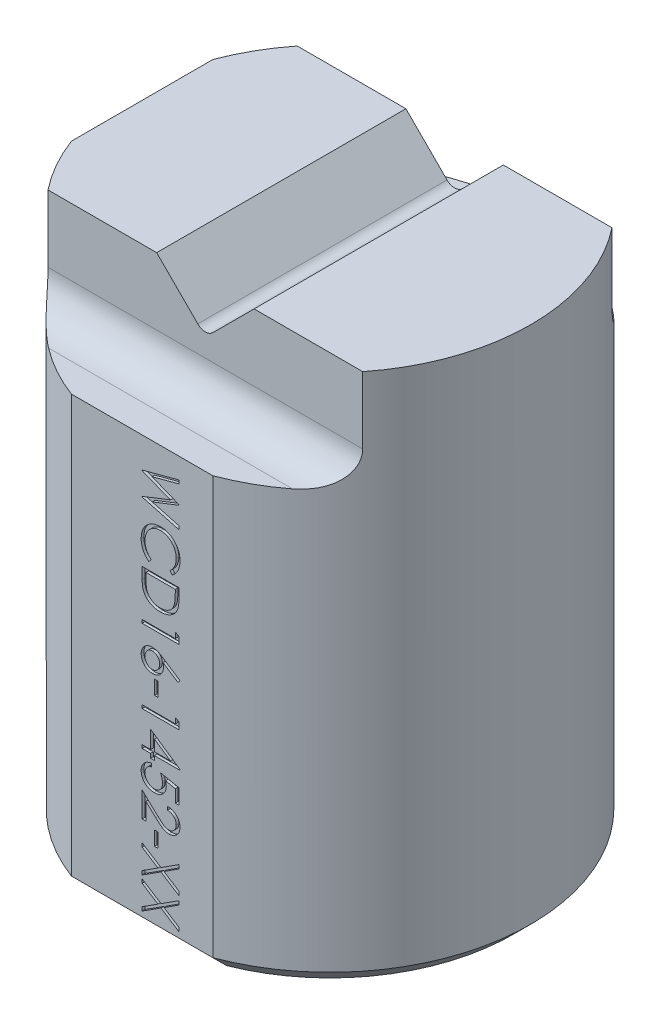
from build123d import *

# Parameters (mm, degrees)
CROQUIS1_R                 = 19.0246
SALIENTE_EXTRUIR1_DEPTH    = 50.8
CORTAR_EXTRUIR5_DEPTH      = 50.8
CORTAR_EXTRUIR5_DEPTH_BACK = 50.8
CORTAR_EXTRUIR7_DEPTH      = 50.8
CORTAR_EXTRUIR7_DEPTH_BACK = 50.8
CORTAR_EXTRUIR4_START      = -50.8
CORTAR_EXTRUIR4_DEPTH      = 50.8
CHAFL_N1_SIZE              = 1.5875
CROQUIS16_W                = 0.358974359
CROQUIS16_H                = 1.346153846
CORTAR_EXTRUIR8_DEPTH      = 0.254


with BuildPart() as part:
    # Croquis1 → Saliente-Extruir1 (new body)
    with BuildSketch(Plane(origin=(0, 0, 0), x_dir=(1, 0, 0), z_dir=(0, 1, 0))):
        with Locations(Location((0, 0, 0), (0, 0, 270))):
            Circle(CROQUIS1_R)
    extrude(amount=SALIENTE_EXTRUIR1_DEPTH)

    # Croquis12 → Cortar-Extruir5 (cut, two sides: drawn at the far end of the back side and taken through both)
    with BuildSketch(Plane(origin=(0, 0, 0), x_dir=(0, 0, -1), z_dir=(1, 0, 0)).offset(-CORTAR_EXTRUIR5_DEPTH_BACK)):
        with BuildLine():
            Line((11.811, 50.8), (19.0246, 50.8))
            Line((19.0246, 50.8), (19.0246, 41.148))
            Line((19.0246, 41.148), (15.113, 41.148))
            ThreePointArc((15.113, 41.148), (12.778133409, 42.115133409), (11.811, 44.45))
            Line((11.811, 44.45), (11.811, 50.8))
        make_face()
        with BuildLine():
            Line((-11.811, 50.8), (-19.0246, 50.8))
            Line((-19.0246, 50.8), (-19.0246, 41.148))
            Line((-19.0246, 41.148), (-15.113, 41.148))
            ThreePointArc((-15.113, 41.148), (-12.778133409, 42.115133409), (-11.811, 44.45))
            Line((-11.811, 44.45), (-11.811, 50.8))
        make_face()
    extrude(amount=CORTAR_EXTRUIR5_DEPTH + CORTAR_EXTRUIR5_DEPTH_BACK, mode=Mode.SUBTRACT)

    # Croquis14 → Cortar-Extruir7 (cut, two sides: drawn at the far end of the back side and taken through both)
    with BuildSketch(Plane.XY.offset(-CORTAR_EXTRUIR7_DEPTH_BACK)):
        with BuildLine():
            Line((-4.615851646, 50.8), (-0.71842049, 46.902568843))
            ThreePointArc((-0.71842049, 46.902568843), (0, 46.604989333), (0.71842049, 46.902568843))
            Line((0.71842049, 46.902568843), (4.615851646, 50.8))
            Line((4.615851646, 50.8), (-4.615851646, 50.8))
        make_face()
    extrude(amount=CORTAR_EXTRUIR7_DEPTH + CORTAR_EXTRUIR7_DEPTH_BACK, mode=Mode.SUBTRACT)

    # Croquis11 → Cortar-Extruir4 (cut)
    with BuildSketch(Plane(origin=(0, 50.8, 0), x_dir=(1, 0, 0), z_dir=(0, 1, 0)).offset(CORTAR_EXTRUIR4_START)):
        with BuildLine():
            Line((-17.8054, 0), (-17.8054, 6.700980227))
            ThreePointArc((-17.8054, 6.700980227), (-19.0246, 0), (-17.8054, -6.700980227))
            Line((-17.8054, -6.700980227), (-17.8054, 0))
        make_face()
        with BuildLine():
            Line((0, -17.8054), (-6.700980227, -17.8054))
            ThreePointArc((-6.700980227, -17.8054), (0, -19.0246), (6.700980227, -17.8054))
            Line((6.700980227, -17.8054), (0, -17.8054))
        make_face()
    extrude(amount=CORTAR_EXTRUIR4_DEPTH, mode=Mode.SUBTRACT)

    # Chaflán1
    # the kernel refuses this chamfer: 1.5875 mm, written as the material it takes off along each edge
    with BuildSketch(Plane(origin=(10.78352697, 0, 17.8054), x_dir=(0, 0.9996219169112966, 0.027495876610585654), z_dir=(-1, 0, 0)), Plane(origin=(-17.8054, 0, 10.78352697), x_dir=(-0.027495876610585654, 0.9996219169112966, 0), z_dir=(0, 0, -1))) as chafl_n1_piece_1:
        Polygon((CHAFL_N1_SIZE * 0.999621916911, CHAFL_N1_SIZE * 0.0274958766106), (-CHAFL_N1_SIZE * 0.0274958766106, CHAFL_N1_SIZE * 0.999621916911), (0, 0), align=None)
    extrude(amount=21.56705394, mode=Mode.SUBTRACT)
    with BuildSketch(Plane(origin=(0, 0, 0), x_dir=(0.14429341464634798, 0, 0.9895349465732359), z_dir=(-0.9895349465732359, 0, 0.14429341464634798))) as chafl_n1_piece_2:
        Polygon((19.0246 - CHAFL_N1_SIZE, 0), (19.0246, CHAFL_N1_SIZE), (19.0246, 0), align=None)
    revolve(axis=Axis((0, 0, 0), (0, 1, 0)), revolution_arc=253.40727091, mode=Mode.SUBTRACT)
    with BuildSketch(Plane(origin=(0, 0, 0), x_dir=(-0.9894579755550961, 0, 0.14482028383624634), z_dir=(-0.14482028383624634, 0, -0.9894579755550961))) as chafl_n1_piece_3:
        Polygon((19.0246, CHAFL_N1_SIZE), (19.0246 - CHAFL_N1_SIZE, 0), (19.0246, 0), align=None)
    revolve(axis=Axis((0, 0, 0), (0, 1, 0)), revolution_arc=73.346255269, mode=Mode.SUBTRACT)

    # Croquis16 → Cortar-Extruir8 (cut)
    # profile 1 of 13: a face of its own
    with BuildSketch(Plane.XY.offset(17.8054)):
        Polygon((3.5, 4.666948718), (3.5, 4.30446875), (2.069010417, 3.388803686), (3.5, 2.473839744), (3.5, 2.10925641), (1.78505609, 3.206512019), (0, 2.064384615), (0, 2.426864583), (1.501802885, 3.388102564), (0, 4.348639423), (0, 4.711820513), (1.785757212, 3.569693109), align=None)
    # profile 2 of 13: a face of its own
    with BuildSketch(Plane.XY.offset(17.8054)):
        Polygon((3.5, 7.628487179), (3.5, 7.266007212), (2.069010417, 6.350342147), (3.5, 5.435378205), (3.5, 5.070794872), (1.78505609, 6.168050481), (0, 5.025923077), (0, 5.388403045), (1.501802885, 6.349641026), (0, 7.310177885), (0, 7.673358974), (1.785757212, 6.531231571), align=None)
    # profile 3 of 13: a face of its own
    with BuildSketch(Plane.XY.offset(17.8054)):
        with Locations((1.346153847, 8.638102564)):
            Rectangle(CROQUIS16_W, CROQUIS16_H)
    # profile 4 of 13: a face of its own
    with BuildSketch(Plane.XY.offset(17.8054)):
        with BuildLine():
            Line((2.423076923, 11.554769231), (2.423076923, 11.868871795))
            add(Edge.make_bspline(
                [(2.423076923, 11.868871795), (2.464748016, 11.86682499), (2.546588934, 11.862805121), (2.665909934, 11.843971901), (2.779975252, 11.817048868), (2.887806988, 11.778892651), (2.990693283, 11.731773056), (3.087267925, 11.674085036), (3.178489406, 11.607058407), (3.262630601, 11.53081613), (3.339546174, 11.448086233), (3.406669589, 11.359364397), (3.46273344, 11.265562514), (3.5098564, 11.167494181), (3.545184955, 11.06402521), (3.571409677, 10.956144647), (3.587185182, 10.843364885), (3.588881084, 10.766524949), (3.58974359, 10.727445513)],
                knots=[0, 0, 0, 0, 1.100776268, 2.161895295, 3.184016182, 4.190939212, 5.176500551, 6.166955529, 7.155448256, 8.160289653, 9.16017456, 10.133824356, 11.091467644, 12.04088621, 13.000931625, 13.972173743, 14.968683325, 16, 16, 16, 16], degree=3))
            add(Edge.make_bspline(
                [(3.58974359, 10.727445513), (3.588845133, 10.689067439), (3.587079698, 10.613655894), (3.571918669, 10.50359388), (3.548173078, 10.398816585), (3.514857661, 10.299528819), (3.470073234, 10.206522754), (3.416275695, 10.11909971), (3.354055864, 10.036218899), (3.28080205, 9.961612115), (3.202599666, 9.893104036), (3.119111762, 9.834001781), (3.032882477, 9.783388617), (2.943254275, 9.741200937), (2.849383247, 9.710144798), (2.752636044, 9.68656659), (2.652011233, 9.673239177), (2.583904677, 9.671193753), (2.549278846, 9.670153846)],
                knots=[0, 0, 0, 0, 1.111607364, 2.184268762, 3.212621178, 4.221274766, 5.211760367, 6.196651075, 7.1921475, 8.207485113, 9.220403448, 10.201281604, 11.166441695, 12.114753415, 13.065576456, 14.026450734, 14.996634279, 16, 16, 16, 16], degree=3))
            add(Edge.make_bspline(
                [(2.549278846, 9.670153846), (2.500531028, 9.671844829), (2.403890848, 9.67519712), (2.261657256, 9.703989144), (2.123960365, 9.748782887), (2.012708427, 9.80201516), (1.923621611, 9.856555617), (1.850138441, 9.905614056), (1.771037485, 9.963087935), (1.68655876, 10.029763645), (1.596048281, 10.104277374), (1.499558358, 10.18729928), (1.398086626, 10.279422838), (1.328781019, 10.344081328), (1.29286859, 10.377585737)],
                knots=[0, 0, 0, 0, 1.184136889, 2.347493852, 3.513608722, 4.697895552, 5.335178528, 6.052199267, 6.845488095, 7.711597353, 8.668264519, 9.695616787, 10.805926351, 12, 12, 12, 12], degree=3))
            Line((1.29286859, 10.377585737), (0.358974359, 11.253286859))
            Line((0.358974359, 11.253286859), (0.358974359, 9.625282051))
            Line((0.358974359, 9.625282051), (0, 9.625282051))
            Line((0, 9.625282051), (0, 12.003487179))
            Line((0, 12.003487179), (1.448517628, 10.646115385))
            add(Edge.make_bspline(
                [(1.448517628, 10.646115385), (1.483014053, 10.613065158), (1.549274626, 10.549582437), (1.646042341, 10.459830643), (1.735709677, 10.379089433), (1.818673971, 10.307305249), (1.894464892, 10.244419025), (1.963676397, 10.19063197), (2.025714532, 10.145706354), (2.098594339, 10.098094564), (2.187681869, 10.052693562), (2.296003864, 10.012790727), (2.407759457, 9.988634094), (2.483257707, 9.98572148), (2.521233974, 9.98425641)],
                knots=[0, 0, 0, 0, 1.329530082, 2.553755191, 3.672934919, 4.687409497, 5.60679272, 6.413407421, 7.126401618, 7.737995624, 8.834647426, 9.90044882, 10.943907757, 12, 12, 12, 12], degree=3))
            add(Edge.make_bspline(
                [(2.521233974, 9.98425641), (2.545118012, 9.984885622), (2.592188863, 9.986125678), (2.661156757, 9.997277074), (2.727942288, 10.013660688), (2.7917197, 10.038912898), (2.853743372, 10.069252499), (2.91212759, 10.108013576), (2.968862533, 10.152307309), (3.022002807, 10.203685867), (3.07068755, 10.260089976), (3.113810711, 10.319686161), (3.149850063, 10.38273576), (3.179393496, 10.448976018), (3.202568894, 10.51822145), (3.218627469, 10.590606205), (3.228709954, 10.665930219), (3.230074126, 10.717363715), (3.230769231, 10.743571314)],
                knots=[0, 0, 0, 0, 0.991504627, 1.954065223, 2.895985987, 3.842598665, 4.797835564, 5.759220273, 6.74786863, 7.784730864, 8.824135544, 9.839918996, 10.835834653, 11.835434876, 12.84861661, 13.863796685, 14.911511676, 16, 16, 16, 16], degree=3))
            add(Edge.make_bspline(
                [(3.230769231, 10.743571314), (3.230054415, 10.770942268), (3.228650634, 10.824694303), (3.218824902, 10.903611613), (3.201890229, 10.978903664), (3.178673151, 11.050722869), (3.149442666, 11.119138426), (3.112332364, 11.183531721), (3.068791169, 11.244490644), (3.019156583, 11.301903234), (2.963634417, 11.354656397), (2.902503649, 11.40198027), (2.835366634, 11.442342532), (2.763739792, 11.47812186), (2.685718657, 11.505498341), (2.603193858, 11.528899494), (2.514992916, 11.545898701), (2.454224465, 11.551763277), (2.423076923, 11.554769231)],
                knots=[0, 0, 0, 0, 1.031212865, 2.025131798, 2.990757446, 3.934781266, 4.865570067, 5.788494791, 6.729227313, 7.684356718, 8.643577152, 9.610526866, 10.590658432, 11.59095419, 12.621640561, 13.700587263, 14.82141059, 16, 16, 16, 16], degree=3))
        make_face()
    # profile 5 of 13: a face of its own
    with BuildSketch(Plane.XY.offset(17.8054)):
        with BuildLine():
            Line((3.5, 12.497076923), (3.141025641, 12.497076923))
            Line((3.141025641, 12.497076923), (3.141025641, 13.686880609))
            Line((3.141025641, 13.686880609), (2.220452724, 13.876183494))
            add(Edge.make_bspline(
                [(2.220452724, 13.876183494), (2.230682996, 13.839127619), (2.25050253, 13.767337723), (2.2725083, 13.661377862), (2.285773744, 13.560785659), (2.287585055, 13.495510289), (2.288461538, 13.463923878)],
                knots=[0, 0, 0, 0, 1.100273476, 2.13160584, 3.095893838, 4, 4, 4, 4], degree=3))
            add(Edge.make_bspline(
                [(2.288461538, 13.463923878), (2.287615381, 13.424840273), (2.285951625, 13.347992141), (2.269982922, 13.235551278), (2.244831581, 13.128225344), (2.20975253, 13.026197713), (2.16460626, 12.929248626), (2.108941852, 12.837919492), (2.043144334, 12.751692715), (1.967848539, 12.671708181), (1.884877575, 12.599258758), (1.795958621, 12.535307426), (1.701010796, 12.482120557), (1.600453954, 12.438362922), (1.494456815, 12.403645464), (1.382234792, 12.380474877), (1.264783752, 12.36506331), (1.184479588, 12.363340209), (1.143529647, 12.362461538)],
                knots=[0, 0, 0, 0, 1.052772836, 2.070014431, 3.053871312, 4.019926262, 4.972333346, 5.930471369, 6.896690565, 7.89035727, 8.885779078, 9.861050232, 10.836829716, 11.812751485, 12.812646763, 13.836748493, 14.896881366, 16, 16, 16, 16], degree=3))
            add(Edge.make_bspline(
                [(1.143529647, 12.362461538), (1.11500739, 12.363126524), (1.058348328, 12.364447509), (0.974204676, 12.37116741), (0.891839802, 12.38409824), (0.81125494, 12.401483994), (0.732557826, 12.423959989), (0.655777085, 12.451464292), (0.580676295, 12.483885086), (0.507250538, 12.520488929), (0.437763412, 12.562832793), (0.371142281, 12.607437111), (0.309838941, 12.656846418), (0.251615412, 12.708668561), (0.198758223, 12.764975694), (0.149005388, 12.824020133), (0.104518066, 12.887187505), (0.063599772, 12.953346878), (0.026963122, 13.022456533), (-0.003598389, 13.095217228), (-0.030385817, 13.170031676), (-0.052169495, 13.247566689), (-0.069070481, 13.327672058), (-0.080579823, 13.410623634), (-0.088953871, 13.496005178), (-0.089478555, 13.553880071), (-0.08974359, 13.583114583)],
                knots=[0, 0, 0, 0, 1.05623316, 2.098192244, 3.122504159, 4.140841222, 5.148757784, 6.150489607, 7.158294732, 8.176043417, 9.185147859, 10.169157858, 11.142149047, 12.097904048, 13.0527185, 13.998867679, 14.954465986, 15.910220987, 16.877849176, 17.847023716, 18.829548819, 19.818454515, 20.826519638, 21.858115382, 22.918063636, 24, 24, 24, 24], degree=3))
            add(Edge.make_bspline(
                [(-0.08974359, 13.583114583), (-0.089052691, 13.617988721), (-0.08769343, 13.686599468), (-0.073475808, 13.787120644), (-0.053108741, 13.883833027), (-0.02248395, 13.975971225), (0.015945705, 14.064312609), (0.064206634, 14.147681188), (0.119660638, 14.227715607), (0.184221067, 14.302240627), (0.255448024, 14.371268491), (0.331914473, 14.434008824), (0.413924458, 14.489031719), (0.500779798, 14.536561723), (0.592629943, 14.577045569), (0.689749741, 14.608864467), (0.791650622, 14.634541751), (0.861804012, 14.645405319), (0.897435897, 14.650923077)],
                knots=[0, 0, 0, 0, 1.046825758, 2.059506013, 3.044032586, 4.011925612, 4.970610144, 5.93275819, 6.900651216, 7.891265644, 8.889116719, 9.876966323, 10.858259055, 11.851035124, 12.847502422, 13.86866322, 14.9174643, 16, 16, 16, 16], degree=3))
            Line((0.897435897, 14.650923077), (0.897435897, 14.336820513))
            add(Edge.make_bspline(
                [(0.897435897, 14.336820513), (0.864056261, 14.329096819), (0.799898745, 14.314251452), (0.709809781, 14.281580974), (0.629226092, 14.241881547), (0.5580716, 14.193600698), (0.495697109, 14.137172103), (0.439632625, 14.073243352), (0.389723386, 14.000903697), (0.34785381, 13.920549253), (0.312197898, 13.835725533), (0.288442785, 13.746961156), (0.271742785, 13.656656069), (0.270070904, 13.595577798), (0.269230769, 13.564885417)],
                knots=[0, 0, 0, 0, 1.136389429, 2.184203582, 3.172920998, 4.111012962, 5.028380909, 5.957351669, 6.927793475, 7.937618031, 8.960409703, 9.974842029, 10.982339866, 12, 12, 12, 12], degree=3))
            add(Edge.make_bspline(
                [(0.269230769, 13.564885417), (0.270051547, 13.534926972), (0.271667666, 13.47593855), (0.284106678, 13.389127163), (0.303264249, 13.305314289), (0.331934104, 13.225326932), (0.366778822, 13.147765393), (0.411493898, 13.074591622), (0.462953917, 13.003688745), (0.521910547, 12.937260612), (0.586880241, 12.876421162), (0.656357635, 12.822665041), (0.730474481, 12.777888128), (0.807947634, 12.740154019), (0.889626191, 12.71150072), (0.975127366, 12.691059739), (1.064662347, 12.67905668), (1.125731656, 12.6774055), (1.156850962, 12.676564103)],
                knots=[0, 0, 0, 0, 1.027316725, 2.022795036, 3.002884548, 3.971462791, 4.93288096, 5.914575861, 6.907176829, 7.935150275, 8.956128384, 9.956726525, 10.942570165, 11.921478529, 12.907843606, 13.90538589, 14.932640048, 16, 16, 16, 16], degree=3))
            add(Edge.make_bspline(
                [(1.156850962, 12.676564103), (1.18494363, 12.677116522), (1.239962545, 12.678198425), (1.320101712, 12.690221023), (1.396479006, 12.707062818), (1.468411408, 12.732921244), (1.536952265, 12.764871524), (1.600634552, 12.805406609), (1.661094376, 12.851742387), (1.715875584, 12.906014398), (1.766777344, 12.96519572), (1.810106091, 13.03066015), (1.846574147, 13.100914496), (1.878041003, 13.175145636), (1.900642067, 13.255110105), (1.917609863, 13.339226858), (1.927425251, 13.428403533), (1.928787135, 13.489374225), (1.929487179, 13.520714744)],
                knots=[0, 0, 0, 0, 1.045726679, 2.048034203, 3.01323695, 3.95502507, 4.889743367, 5.8246644, 6.761650845, 7.722168973, 8.692072792, 9.66525385, 10.638902184, 11.638179751, 12.663148338, 13.728659964, 14.832472288, 16, 16, 16, 16], degree=3))
            add(Edge.make_bspline(
                [(1.929487179, 13.520714744), (1.928926304, 13.548079266), (1.927778104, 13.604098693), (1.918742011, 13.690228466), (1.904840851, 13.780344066), (1.884804843, 13.874795351), (1.859718381, 13.973323116), (1.828388536, 14.076091213), (1.792300505, 14.183102126), (1.764309399, 14.255128133), (1.75, 14.291948718)],
                knots=[0, 0, 0, 0, 0.824638674, 1.688163388, 2.607705698, 3.571998603, 4.597075385, 5.671199175, 6.809488238, 8, 8, 8, 8], degree=3))
            Line((1.75, 14.291948718), (3.5, 13.932974359))
            Line((3.5, 13.932974359), (3.5, 12.497076923))
        make_face()
    # profile 6 of 13: a face of its own
    with BuildSketch(Plane.XY.offset(17.8054)):
        Polygon((3.58974359, 15.477545673), (3.58974359, 15.41374359), (1.166666667, 15.41374359), (1.166666667, 15.009897436), (0.807692308, 15.009897436), (0.807692308, 15.41374359), (0, 15.41374359), (0, 15.727846154), (0.807692308, 15.727846154), (0.807692308, 17.388102564), align=None)
        Polygon((1.166666667, 15.727846154), (2.685296474, 15.727846154), (1.166666667, 16.770414263), align=None, mode=Mode.SUBTRACT)
    # profile 7 of 13: a face of its own
    with BuildSketch(Plane.XY.offset(17.8054)):
        Polygon((3.5, 19.336520032), (3.5, 18.689384615), (0, 18.689384615), (0, 19.003487179), (3.141025641, 19.003487179), (3.141025641, 19.541948718), align=None)
    # profile 8 of 13: a face of its own
    with BuildSketch(Plane.XY.offset(17.8054)):
        with Locations((1.346153847, 21.022717949)):
            Rectangle(CROQUIS16_W, CROQUIS16_H)
    # profile 9 of 13: a face of its own
    with BuildSketch(Plane.XY.offset(17.8054)):
        with BuildLine():
            Line((3.58974359, 22.772717949), (3.399739583, 22.530129808))
            Line((3.399739583, 22.530129808), (1.985576923, 23.454909455))
            add(Edge.make_bspline(
                [(1.985576923, 23.454909455), (1.995390784, 23.393339178), (2.014533829, 23.273239391), (2.017691774, 23.151673493), (2.019230769, 23.092429487)],
                knots=[0, 0, 0, 0, 1.025318673, 2, 2, 2, 2], degree=3))
            add(Edge.make_bspline(
                [(2.019230769, 23.092429487), (2.018288505, 23.056855201), (2.016439821, 22.987059892), (2.001830242, 22.884505458), (1.979090511, 22.785938065), (1.945809534, 22.691577603), (1.903309502, 22.601304315), (1.852370002, 22.514602002), (1.790364494, 22.433099969), (1.721099491, 22.355748796), (1.644382519, 22.285521697), (1.562981179, 22.223345642), (1.476980299, 22.17111885), (1.386423433, 22.128744928), (1.291450173, 22.09584005), (1.192182034, 22.071852405), (1.088550562, 22.057672812), (1.018072387, 22.055747321), (0.982271635, 22.054769231)],
                knots=[0, 0, 0, 0, 1.044136307, 2.048553127, 3.035567123, 4.010001674, 4.980053131, 5.96154148, 6.956538004, 7.981742224, 9.006487041, 10.005615874, 10.984750588, 11.954802044, 12.935714515, 13.930994945, 14.949008866, 16, 16, 16, 16], degree=3))
            add(Edge.make_bspline(
                [(0.982271635, 22.054769231), (0.933321047, 22.056595759), (0.83705467, 22.060187816), (0.696257255, 22.086336465), (0.563199166, 22.131463191), (0.437357507, 22.191837339), (0.322393647, 22.270168048), (0.218497146, 22.362994245), (0.127936082, 22.471193397), (0.050247518, 22.592203324), (-0.011475948, 22.723173645), (-0.057109366, 22.860500311), (-0.084376494, 23.003009528), (-0.087946329, 23.099792894), (-0.08974359, 23.148519231)],
                knots=[0, 0, 0, 0, 1.031881447, 2.029301251, 3.006342947, 3.987068354, 4.962916383, 5.929513747, 6.915671209, 7.928552063, 8.953527267, 9.960179832, 10.973036711, 12, 12, 12, 12], degree=3))
            add(Edge.make_bspline(
                [(-0.08974359, 23.148519231), (-0.088215388, 23.195615941), (-0.085188287, 23.288906276), (-0.058222293, 23.426138938), (-0.014515404, 23.558002458), (0.045699679, 23.683569946), (0.12175457, 23.7998976), (0.213327878, 23.903937278), (0.318395727, 23.995327004), (0.437280428, 24.070981528), (0.56420709, 24.13264017), (0.697761511, 24.176128902), (0.835255853, 24.204253179), (0.928849864, 24.207154812), (0.975961538, 24.208615385)],
                knots=[0, 0, 0, 0, 1.011913813, 2.004424092, 2.994488568, 3.992479987, 4.990471406, 5.973328987, 6.963763268, 7.974390938, 8.994854117, 9.989689954, 10.988086187, 12, 12, 12, 12], degree=3))
            add(Edge.make_bspline(
                [(0.975961538, 24.208615385), (1.011992998, 24.207346936), (1.085529615, 24.20475816), (1.197225054, 24.189308639), (1.311065619, 24.160972332), (1.407571272, 24.130306253), (1.487495437, 24.099876247), (1.550609439, 24.071660844), (1.617259852, 24.040112586), (1.686185585, 24.003133635), (1.759355993, 23.963932962), (1.834061355, 23.918142127), (1.913030141, 23.870358688), (1.965606332, 23.835353759), (1.992588141, 23.817389423)],
                knots=[0, 0, 0, 0, 1.17367173, 2.395347028, 3.66355231, 4.98980831, 5.690886799, 6.447442954, 7.240630024, 8.091733897, 8.994365608, 9.943299771, 10.944512865, 12, 12, 12, 12], degree=3))
            Line((1.992588141, 23.817389423), (3.58974359, 22.772717949))
        make_face()
        with BuildLine():
            add(Edge.make_bspline(
                [(1.66025641, 23.158334936), (1.659468059, 23.184996342), (1.657921319, 23.237305803), (1.649185356, 23.313954558), (1.632633, 23.38630165), (1.611222464, 23.455173907), (1.582069354, 23.519851671), (1.547081535, 23.581079486), (1.505467755, 23.638224697), (1.457762962, 23.690377722), (1.405981035, 23.738091502), (1.350942584, 23.780095357), (1.292870682, 23.815504814), (1.232264974, 23.84443574), (1.168808743, 23.866912627), (1.102852139, 23.883184462), (1.033937119, 23.892237247), (0.987204715, 23.893743612), (0.963341346, 23.894512821)],
                knots=[0, 0, 0, 0, 1.129054775, 2.21519617, 3.259426851, 4.267013074, 5.263608451, 6.256463875, 7.247987236, 8.249677815, 9.244060445, 10.225610515, 11.175892485, 12.118571871, 13.063688666, 14.021206195, 14.989551517, 16, 16, 16, 16], degree=3))
            add(Edge.make_bspline(
                [(0.963341346, 23.894512821), (0.939692266, 23.893884845), (0.893319942, 23.892653479), (0.824967916, 23.88152419), (0.759251192, 23.864402723), (0.696121704, 23.839341431), (0.635923815, 23.807907244), (0.578229919, 23.769224011), (0.523000197, 23.723946732), (0.471627345, 23.671312794), (0.424506917, 23.614552194), (0.382550799, 23.554524101), (0.347318879, 23.491419379), (0.31946527, 23.424877948), (0.296652499, 23.35583144), (0.280587851, 23.283753121), (0.271508182, 23.208579661), (0.269999871, 23.157657806), (0.269230769, 23.131692308)],
                knots=[0, 0, 0, 0, 0.989642335, 1.94054129, 2.892446913, 3.828371744, 4.778262963, 5.730973156, 6.732161388, 7.763274768, 8.805796303, 9.818398792, 10.825975928, 11.825728216, 12.834635236, 13.867465554, 14.912602056, 16, 16, 16, 16], degree=3))
            add(Edge.make_bspline(
                [(0.269230769, 23.131692308), (0.26999981, 23.105726767), (0.271508004, 23.054804829), (0.28058853, 22.979631973), (0.296650009, 22.907551419), (0.319474296, 22.838513035), (0.347285394, 22.771941613), (0.382771567, 22.708781653), (0.424251821, 22.648180451), (0.471708445, 22.591457088), (0.522709916, 22.538603154), (0.578729986, 22.494386368), (0.635465272, 22.454481044), (0.69636159, 22.424254156), (0.759213189, 22.39891376), (0.824978097, 22.381878678), (0.893317277, 22.370726358), (0.939691366, 22.369498156), (0.963341346, 22.368871795)],
                knots=[0, 0, 0, 0, 1.087205562, 2.132157158, 3.164804748, 4.173533273, 5.173108684, 6.180507559, 7.20098426, 8.243321352, 9.274252308, 10.269075238, 11.227079059, 12.172305571, 13.108064818, 14.05980203, 15.010532752, 16, 16, 16, 16], degree=3))
            add(Edge.make_bspline(
                [(0.963341346, 22.368871795), (0.987238671, 22.369415674), (1.034141346, 22.370483132), (1.102789445, 22.382790474), (1.169347332, 22.399413587), (1.232315684, 22.426278062), (1.293435829, 22.458275844), (1.350960907, 22.499038917), (1.406520615, 22.545774777), (1.458069581, 22.599899439), (1.505220459, 22.658782225), (1.546839016, 22.721399777), (1.58196424, 22.786907234), (1.611271333, 22.855241312), (1.632420594, 22.927184165), (1.649074723, 23.001574486), (1.657906821, 23.079131391), (1.659465487, 23.131673307), (1.66025641, 23.158334936)],
                knots=[0, 0, 0, 0, 0.978850575, 1.921165339, 2.853482305, 3.786193361, 4.721019802, 5.678231452, 6.671107257, 7.694736563, 8.738100728, 9.761595396, 10.773671158, 11.783065439, 12.804898115, 13.84455739, 14.906252091, 16, 16, 16, 16], degree=3))
        make_face(mode=Mode.SUBTRACT)
    # profile 10 of 13: a face of its own
    with BuildSketch(Plane.XY.offset(17.8054)):
        Polygon((3.5, 26.336520032), (3.5, 25.689384615), (0, 25.689384615), (0, 26.003487179), (3.141025641, 26.003487179), (3.141025641, 26.541948718), align=None)
    # profile 11 of 13: a face of its own
    with BuildSketch(Plane.XY.offset(17.8054)):
        with BuildLine():
            Line((0, 30.356051282), (3.5, 30.356051282))
            Line((3.5, 30.356051282), (3.5, 29.649320513))
            add(Edge.make_bspline(
                [(3.5, 29.649320513), (3.499558636, 29.587851397), (3.498705923, 29.469093385), (3.493268378, 29.297482649), (3.483746477, 29.138925357), (3.469609165, 28.993511552), (3.452640429, 28.861007616), (3.431060433, 28.741625767), (3.405680896, 28.635172539), (3.384034427, 28.569703226), (3.373798077, 28.53874359)],
                knots=[0, 0, 0, 0, 1.314317071, 2.539253741, 3.67075822, 4.709970291, 5.662644612, 6.526156501, 7.303037452, 8, 8, 8, 8], degree=3))
            add(Edge.make_bspline(
                [(3.373798077, 28.53874359), (3.358367354, 28.498248876), (3.327855826, 28.418177735), (3.270299776, 28.304170239), (3.205085737, 28.196846265), (3.132133327, 28.095622001), (3.049356095, 28.002840279), (2.960347486, 27.914760501), (2.861470361, 27.835336639), (2.756081895, 27.761381368), (2.643112969, 27.696669297), (2.524856338, 27.639600767), (2.401533274, 27.590874206), (2.272246166, 27.552854069), (2.138236163, 27.521442961), (1.998488812, 27.500366855), (1.853818803, 27.486366851), (1.755643076, 27.484966792), (1.705829327, 27.48425641)],
                knots=[0, 0, 0, 0, 0.98467389, 1.947018643, 2.898343565, 3.837828625, 4.779009928, 5.722093987, 6.681368302, 7.658573986, 8.646467994, 9.637429229, 10.641859304, 11.657149908, 12.698561448, 13.768651538, 14.867827761, 16, 16, 16, 16], degree=3))
            add(Edge.make_bspline(
                [(1.705829327, 27.48425641), (1.662568235, 27.484885802), (1.577317734, 27.486126083), (1.451674744, 27.497249332), (1.329768825, 27.513447821), (1.212135374, 27.538411621), (1.097981959, 27.569086111), (0.987850679, 27.606947891), (0.881660811, 27.651817765), (0.780277346, 27.703875831), (0.683868003, 27.760799015), (0.594091818, 27.823211956), (0.509241366, 27.887533188), (0.433143845, 27.958722291), (0.361446986, 28.031873544), (0.298024701, 28.110866017), (0.240114366, 28.193126183), (0.188138683, 28.2802385), (0.143044021, 28.374290919), (0.104412226, 28.47656713), (0.072602821, 28.587614895), (0.04602105, 28.707264004), (0.024946939, 28.835748905), (0.010819612, 28.973187454), (0.001266947, 29.119370863), (0.000430516, 29.219750112), (0, 29.271415865)],
                knots=[0, 0, 0, 0, 1.105818345, 2.179130549, 3.222742436, 4.24813173, 5.251184997, 6.243232575, 7.223185975, 8.195898781, 9.155064964, 10.083206407, 10.990357329, 11.874224667, 12.744762365, 13.607037788, 14.46074101, 15.315384698, 16.197310979, 17.123950979, 18.107232398, 19.148086642, 20.256146639, 21.433991621, 22.679261309, 24, 24, 24, 24], degree=3))
            Line((0, 29.271415865), (0, 30.356051282))
        make_face()
        with BuildLine():
            Line((0.358974359, 30.041948718), (0.358974359, 29.640205929))
            add(Edge.make_bspline(
                [(0.358974359, 29.640205929), (0.359222455, 29.582477559), (0.359699636, 29.47144476), (0.363886839, 29.311786763), (0.370728776, 29.165907367), (0.380303854, 29.033785857), (0.392972469, 28.915496833), (0.407097372, 28.810793083), (0.424694823, 28.720017825), (0.440645782, 28.665088388), (0.448016827, 28.639705128)],
                knots=[0, 0, 0, 0, 1.375205317, 2.645023457, 3.804390687, 4.853969522, 5.800190428, 6.637939096, 7.370582563, 8, 8, 8, 8], degree=3))
            add(Edge.make_bspline(
                [(0.448016827, 28.639705128), (0.459267547, 28.607756091), (0.481500263, 28.544621117), (0.522070049, 28.453749801), (0.570067383, 28.368956755), (0.623734571, 28.288827338), (0.683902764, 28.213880417), (0.750754071, 28.144448473), (0.823549172, 28.080038028), (0.90256076, 28.021353669), (0.987278009, 27.968916104), (1.076622395, 27.923210955), (1.170378287, 27.884430811), (1.268883606, 27.852896951), (1.372045499, 27.828460022), (1.47959257, 27.811073435), (1.59155837, 27.80026474), (1.667710145, 27.799002456), (1.706530449, 27.798358974)],
                knots=[0, 0, 0, 0, 0.998463025, 1.973077781, 2.929496817, 3.867873318, 4.813809365, 5.759268434, 6.706333209, 7.676553387, 8.657505312, 9.640584699, 10.632319813, 11.645628493, 12.686877747, 13.755137172, 14.855624085, 16, 16, 16, 16], degree=3))
            add(Edge.make_bspline(
                [(1.706530449, 27.798358974), (1.747463684, 27.798872809), (1.827877387, 27.799882241), (1.945871557, 27.812548796), (2.059339618, 27.831098453), (2.168363263, 27.857780687), (2.27280065, 27.892251833), (2.373241804, 27.933499353), (2.468394145, 27.983580318), (2.559063575, 28.040277264), (2.643876965, 28.10392997), (2.721840679, 28.174256075), (2.793099946, 28.250514032), (2.857768222, 28.332352393), (2.91469547, 28.420915395), (2.965337062, 28.514704379), (3.00836517, 28.615040488), (3.031242353, 28.684854498), (3.04286859, 28.720334135)],
                knots=[0, 0, 0, 0, 1.122272916, 2.204715076, 3.251197285, 4.274229216, 5.279697671, 6.265416158, 7.248880903, 8.225321784, 9.195852973, 10.153576302, 11.101466393, 12.055578741, 13.010401466, 13.985536859, 14.976245305, 16, 16, 16, 16], degree=3))
            add(Edge.make_bspline(
                [(3.04286859, 28.720334135), (3.050985018, 28.749685281), (3.06824277, 28.812093871), (3.087068143, 28.913933335), (3.103672642, 29.028548485), (3.117730681, 29.156448186), (3.127818002, 29.297486645), (3.135389317, 29.451772333), (3.140495949, 29.619371937), (3.140844657, 29.735554471), (3.141025641, 29.795854968)],
                knots=[0, 0, 0, 0, 0.674548936, 1.434276114, 2.292660221, 3.240891867, 4.284742987, 5.42552168, 6.663806718, 8, 8, 8, 8], degree=3))
            Line((3.141025641, 29.795854968), (3.141025641, 30.041948718))
            Line((3.141025641, 30.041948718), (0.358974359, 30.041948718))
        make_face(mode=Mode.SUBTRACT)
    # profile 12 of 13: a face of its own
    with BuildSketch(Plane.XY.offset(17.8054)):
        with BuildLine():
            Line((2.857772436, 31.074), (2.647435897, 31.348839744))
            add(Edge.make_bspline(
                [(2.647435897, 31.348839744), (2.670801867, 31.368445632), (2.717218783, 31.407393079), (2.782398327, 31.470052281), (2.843463589, 31.535353924), (2.900705469, 31.603273045), (2.952122234, 31.675032165), (3.000393337, 31.748892964), (3.043661075, 31.826091009), (3.096124061, 31.932842743), (3.150870216, 32.072490592), (3.196773448, 32.248285431), (3.225994623, 32.431796529), (3.229159465, 32.556994129), (3.230769231, 32.620674679)],
                knots=[0, 0, 0, 0, 0.757959112, 1.505699292, 2.245454638, 2.979532153, 3.711538275, 4.438200793, 5.171680507, 5.909471876, 7.393775596, 8.890124382, 10.418191784, 12, 12, 12, 12], degree=3))
            add(Edge.make_bspline(
                [(3.230769231, 32.620674679), (3.230363445, 32.655757552), (3.229555641, 32.725597696), (3.218973416, 32.829252463), (3.20392868, 32.931167996), (3.1821483, 33.030965307), (3.153792222, 33.128446244), (3.120538112, 33.224353044), (3.079156746, 33.317556181), (3.033456552, 33.40917733), (2.981823731, 33.496952488), (2.925523467, 33.580020465), (2.865108338, 33.658001763), (2.800734294, 33.73111247), (2.731601295, 33.798550768), (2.658522608, 33.861397458), (2.580618642, 33.918519893), (2.499350418, 33.971321758), (2.41459849, 34.018305975), (2.326896016, 34.05887912), (2.236578315, 34.09365368), (2.143460367, 34.121425031), (2.047908611, 34.14333003), (1.949720267, 34.158462999), (1.849085923, 34.168950027), (1.780876701, 34.169750401), (1.746494391, 34.170153846)],
                knots=[0, 0, 0, 0, 1.055000685, 2.100209969, 3.131349012, 4.153242145, 5.170189196, 6.184191144, 7.204341339, 8.235672124, 9.263040994, 10.265373269, 11.252624173, 12.22887325, 13.193405896, 14.155809299, 15.126090485, 16.097288279, 17.069732292, 18.038585918, 19.002221264, 19.978698174, 20.959418239, 21.948869816, 22.966084182, 24, 24, 24, 24], degree=3))
            add(Edge.make_bspline(
                [(1.746494391, 34.170153846), (1.694763071, 34.168892027), (1.593195486, 34.166414613), (1.444424876, 34.144366279), (1.301904202, 34.110861187), (1.16652436, 34.060645611), (1.036616002, 33.99872656), (0.914377148, 33.920485948), (0.797960584, 33.829869411), (0.690117636, 33.725594992), (0.591603911, 33.611189176), (0.504853329, 33.488441264), (0.432538447, 33.357656976), (0.3723625, 33.220280346), (0.326105772, 33.075254232), (0.293541649, 32.92283943), (0.272299468, 32.763367435), (0.27026578, 32.654398035), (0.269230769, 32.598939904)],
                knots=[0, 0, 0, 0, 1.029171465, 2.020641659, 2.987623507, 3.938342917, 4.889210282, 5.84687017, 6.821220943, 7.821438502, 8.827599549, 9.822697543, 10.807740252, 11.797342354, 12.80366471, 13.83203677, 14.896651826, 16, 16, 16, 16], degree=3))
            add(Edge.make_bspline(
                [(0.269230769, 32.598939904), (0.270919549, 32.537837215), (0.274243472, 32.417572506), (0.302402721, 32.24120448), (0.348060638, 32.072368714), (0.411958561, 31.911056127), (0.495023849, 31.757721481), (0.595721726, 31.612124821), (0.715010059, 31.47414325), (0.806093187, 31.391171968), (0.852564103, 31.348839744)],
                knots=[0, 0, 0, 0, 1.028121516, 2.023589091, 2.998037872, 3.967518031, 4.937445131, 5.927275754, 6.942489185, 8, 8, 8, 8], degree=3))
            Line((0.852564103, 31.348839744), (0.644330929, 31.074))
            add(Edge.make_bspline(
                [(0.644330929, 31.074), (0.615792429, 31.096118081), (0.558852125, 31.140248297), (0.478581139, 31.21170675), (0.403074401, 31.28698242), (0.332956835, 31.366644183), (0.266764666, 31.449739281), (0.206716932, 31.537731395), (0.150984484, 31.629100729), (0.100628049, 31.724379249), (0.05547798, 31.823254144), (0.017361042, 31.925622515), (-0.015946051, 32.030617092), (-0.04316627, 32.138290751), (-0.064445988, 32.2490032), (-0.078663293, 32.362374582), (-0.088405847, 32.478644212), (-0.089293675, 32.557085667), (-0.08974359, 32.596836538)],
                knots=[0, 0, 0, 0, 0.986756325, 1.968786143, 2.935506311, 3.899499537, 4.868307269, 5.8376204, 6.809456583, 7.792545619, 8.781780509, 9.778496008, 10.776623214, 11.79151764, 12.812666265, 13.856269958, 14.913646641, 16, 16, 16, 16], degree=3))
            add(Edge.make_bspline(
                [(-0.08974359, 32.596836538), (-0.089481597, 32.634480206), (-0.088963539, 32.708915896), (-0.080571372, 32.818814647), (-0.069121635, 32.925804228), (-0.051881504, 33.029578854), (-0.031537164, 33.130704829), (-0.004265907, 33.228265413), (0.026283259, 33.323220624), (0.062188246, 33.415188964), (0.102704429, 33.504248664), (0.148495987, 33.590112476), (0.199177852, 33.672740908), (0.253632863, 33.752946329), (0.313610164, 33.829543913), (0.378276799, 33.903197438), (0.44741481, 33.974319914), (0.497269663, 34.018322599), (0.522335737, 34.040446314)],
                knots=[0, 0, 0, 0, 1.114604814, 2.203992996, 3.262667896, 4.300477797, 5.318619304, 6.316056647, 7.298880507, 8.271930387, 9.238335007, 10.195173496, 11.151986948, 12.108099108, 13.064862484, 14.031167946, 15.010108607, 16, 16, 16, 16], degree=3))
            add(Edge.make_bspline(
                [(0.522335737, 34.040446314), (0.565876926, 34.075881958), (0.652433637, 34.146325434), (0.792719618, 34.236451118), (0.939187827, 34.313598673), (1.092607755, 34.375974594), (1.252635143, 34.424737327), (1.419350657, 34.458518522), (1.592598599, 34.480470127), (1.710435388, 34.482980415), (1.770332532, 34.48425641)],
                knots=[0, 0, 0, 0, 0.994628077, 1.977248131, 2.950237994, 3.925870899, 4.908910175, 5.911660606, 6.938484602, 8, 8, 8, 8], degree=3))
            add(Edge.make_bspline(
                [(1.770332532, 34.48425641), (1.833285352, 34.482694261), (1.957141094, 34.479620829), (2.138952641, 34.453724314), (2.312890308, 34.411559784), (2.479623367, 34.353498946), (2.638197835, 34.276901176), (2.789283438, 34.184173381), (2.93275681, 34.074409835), (3.066783632, 33.948989062), (3.18931972, 33.811414479), (3.297126777, 33.66409756), (3.386844068, 33.507315114), (3.461840291, 33.342797396), (3.519484737, 33.169311678), (3.559837929, 32.987228319), (3.584955044, 32.796889401), (3.588130252, 32.667026976), (3.58974359, 32.601043269)],
                knots=[0, 0, 0, 0, 1.032901378, 2.032168977, 3.007206631, 3.966850309, 4.924221947, 5.891988639, 6.871730993, 7.884084801, 8.900290346, 9.89161143, 10.874607481, 11.860025555, 12.854717796, 13.869097222, 14.917278314, 16, 16, 16, 16], degree=3))
            add(Edge.make_bspline(
                [(3.58974359, 32.601043269), (3.589261812, 32.560828718), (3.588308181, 32.481228065), (3.578996816, 32.363476555), (3.563502411, 32.248830029), (3.542274027, 32.137011231), (3.516255146, 32.027614682), (3.482194419, 31.92176271), (3.442641565, 31.81887891), (3.39824916, 31.718886229), (3.347498469, 31.622872557), (3.292377899, 31.530855366), (3.231615083, 31.443944676), (3.167218841, 31.360505691), (3.096780331, 31.282416887), (3.022593437, 31.207448067), (2.942456775, 31.138188935), (2.886052222, 31.095435479), (2.857772436, 31.074)],
                knots=[0, 0, 0, 0, 1.096705196, 2.170817488, 3.219277236, 4.250701065, 5.274195539, 6.284202015, 7.28098643, 8.279664616, 9.266225751, 10.241373748, 11.203306326, 12.157093976, 13.114198862, 14.069774147, 15.032234603, 16, 16, 16, 16], degree=3))
        make_face()
    # profile 13 of 13: a face of its own
    with BuildSketch(Plane.XY.offset(17.8054)):
        Polygon((3.5, 39.195794872), (3.5, 38.871876603), (0.931089744, 38.186179487), (3.5, 37.168150641), (3.5, 37.122577724), (0.950721154, 36.122076923), (3.5, 35.433575321), (3.5, 35.112461538), (0, 36.056171474), (0, 36.101043269), (2.675480769, 37.154128205), (0, 38.21843109), (0, 38.264004006), align=None)
    extrude(amount=-CORTAR_EXTRUIR8_DEPTH, mode=Mode.SUBTRACT)


solid = part.part
